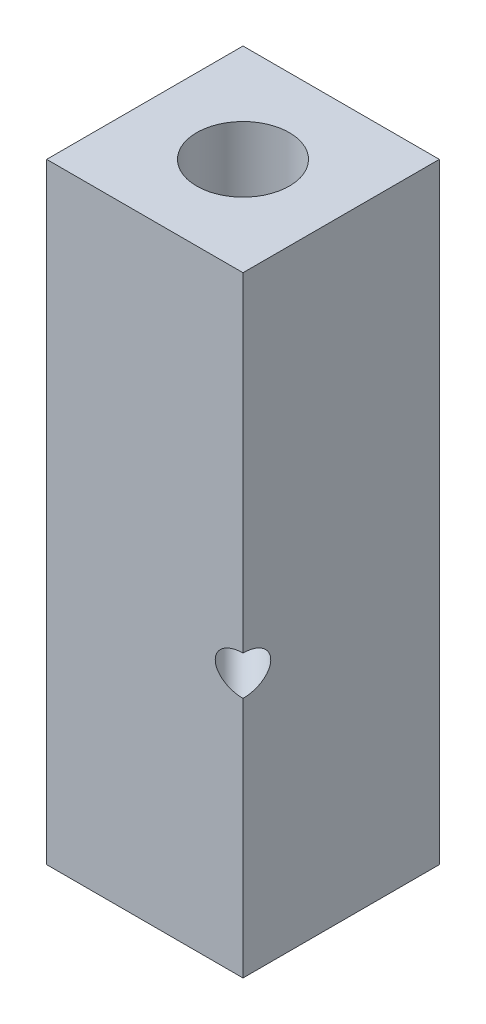
from build123d import *

# Parameters (mm, degrees)
SKETCH1_W              = 9
SKETCH1_H              = 9
SKETCH1_W_2            = 2.5
SKETCH1_H_2            = 6
BOSS_EXTRUDE1_DEPTH    = 8
SKETCH2_W              = 9
SKETCH2_H              = 9
BOSS_EXTRUDE2_DEPTH    = 20
SKETCH3_R              = 2.125
CUT_EXTRUDE2_DEPTH     = 13
CUT_EXTRUDE4_START     = -6.363961131
CUT_EXTRUDE4_OUTLINE_R = 0.9
CUT_EXTRUDE4_DEPTH     = 12.727922262


# Read off the part's stored shape, not the designer's step: Cut-Extrude4
with BuildPart() as part:
    # Sketch1 → Boss-Extrude1 (new body)
    with BuildSketch(Plane(origin=(0, 0, 0), x_dir=(1, 0, 0), z_dir=(0, 1, 0))):
        Rectangle(SKETCH1_W, SKETCH1_H)
        with Locations((-1.75, 0)):
            Rectangle(SKETCH1_W_2, SKETCH1_H_2, mode=Mode.SUBTRACT)
        with Locations((1.75, 0)):
            Rectangle(SKETCH1_W_2, SKETCH1_H_2, mode=Mode.SUBTRACT)
    extrude(amount=BOSS_EXTRUDE1_DEPTH)

    # Sketch2 → Boss-Extrude2 (add)
    with BuildSketch(Plane(origin=(0, 8, 0), x_dir=(1, 0, 0), z_dir=(0, 1, 0))):
        Rectangle(SKETCH2_W, SKETCH2_H)
    extrude(amount=BOSS_EXTRUDE2_DEPTH)

    # Sketch3 → Cut-Extrude2 (cut)
    with BuildSketch(Plane(origin=(0, 28, 0), x_dir=(1, 0, 0), z_dir=(0, 1, 0))):
        with Locations(Location((0, 0, 0), (0, 0, 270))):
            Circle(SKETCH3_R)
    extrude(amount=-CUT_EXTRUDE2_DEPTH, mode=Mode.SUBTRACT)

    # Cut-Extrude4 outline → Cut-Extrude4 (cut)
    with BuildSketch(Plane(origin=(0, 0, 0), x_dir=(0.707106781186548, 0, -0.707106781186547), z_dir=(0.707106781186547, 0, 0.707106781186548)).offset(CUT_EXTRUDE4_START)):
        with Locations((0, 12)):
            Circle(CUT_EXTRUDE4_OUTLINE_R)
    extrude(amount=CUT_EXTRUDE4_DEPTH, mode=Mode.SUBTRACT)


solid = part.part
